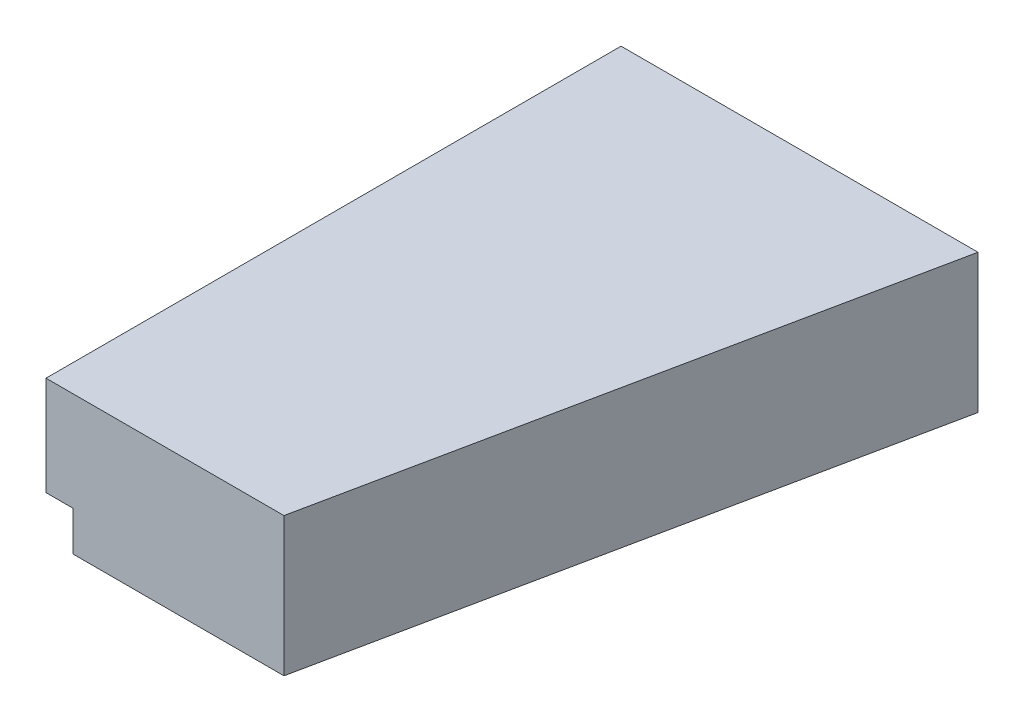
from build123d import *

# Parameters (mm, degrees)
BOSS_EXTRUDE1_DEPTH = 35
BOSS_EXTRUDE2_DEPTH = 10
SKETCH3_W           = 35.357177314
SKETCH3_H           = 3.5
CUT_EXTRUDE1_DEPTH  = 10
CUT_EXTRUDE2_DEPTH  = 0.625
CUT_EXTRUDE3_REACH  = 165.362
SKETCH5_R           = 1.9
SKETCH6_R           = 3.35
CUT_EXTRUDE4_DEPTH  = 2.5
LPATTERN1_COUNT     = 2
LPATTERN1_PITCH     = 52.5
SKETCH7_W           = 6.75
SKETCH7_H           = 145
CUT_EXTRUDE5_DEPTH  = 10


with BuildPart() as part:
    # Sketch1 → Boss-Extrude1 (new body)
    with BuildSketch(Plane(origin=(0, 0, 0), x_dir=(-1, 0, 0), z_dir=(0, 1, 0))):
        Polygon((16.563657866, 147.59508075), (-13.436342134, 2.59508075), (76.563657866, 2.59508075), (76.563657866, 147.59508075), align=None)
        Polygon((-2.190071172, 7.59508075), (24.706480552, 137.59508075), (66.563657866, 137.59508075), (66.563657866, 7.59508075), align=None, mode=Mode.SUBTRACT)
    extrude(amount=BOSS_EXTRUDE1_DEPTH)

    # Sketch2 → Boss-Extrude2 (add)
    with BuildSketch(Plane(origin=(0, 35, 0), x_dir=(-1, 0, 0), z_dir=(0, 1, 0))):
        Polygon((16.563657866, 147.59508075), (76.563657866, 147.59508075), (76.563657866, 2.59508075), (-13.436342134, 2.59508075), align=None)
    extrude(amount=-BOSS_EXTRUDE2_DEPTH)

    # Sketch3 → Cut-Extrude1 (cut)
    with BuildSketch(Plane.XZ):
        with Locations((-45.635069209, 142.59508075)):
            Rectangle(SKETCH3_W, SKETCH3_H)
        Polygon((-17.438004507, 135.780072214), (-20.865415976, 135.0709526), (4.714199322, 11.436145326), (8.141610791, 12.145264941), align=None)
    extrude(amount=-CUT_EXTRUDE1_DEPTH, mode=Mode.SUBTRACT)

    # Sketch4 → Cut-Extrude2 (cut)
    with BuildSketch(Plane(origin=(0, 0, 22.59508075), x_dir=(1, 0, 0), z_dir=(0, 1, 0))):
        Polygon((-66.563657866, 20), (-66.563657866, 15), (2.190071172, 15), (3.224553931, 20), align=None)
    extrude(amount=CUT_EXTRUDE2_DEPTH, mode=Mode.SUBTRACT)

    # Sketch5 → Cut-Extrude3 (cut, up to next)
    with BuildSketch(Plane.XY.offset(7.59508075), mode=Mode.PRIVATE) as cut_extrude3_sk1:
        with Locations((-59.313657866, 5.625)):
            Circle(SKETCH5_R)
    cut_extrude3_tool1 = extrude(cut_extrude3_sk1.sketch, amount=-CUT_EXTRUDE3_REACH, mode=Mode.PRIVATE) & part.part
    cut_extrude3 = cut_extrude3_tool1.solids().sort_by_distance((-59.313658, 5.625, 7.595081))[0]
    add(cut_extrude3, mode=Mode.SUBTRACT)

    # Sketch6 → Cut-Extrude4 (cut)
    with BuildSketch(Plane.XY.offset(7.59508075)):
        with Locations((-59.313657866, 5.625)):
            Circle(SKETCH6_R)
    cut_extrude4 = extrude(amount=-CUT_EXTRUDE4_DEPTH, mode=Mode.SUBTRACT)

    # LPattern1: Cut-Extrude3, Cut-Extrude4 ×2
    with Locations(*[(i * LPATTERN1_PITCH, 0, 0) for i in range(1, LPATTERN1_COUNT)]):
        add(cut_extrude3, mode=Mode.SUBTRACT)
        add(cut_extrude4, mode=Mode.SUBTRACT)

    # Sketch7 → Cut-Extrude5 (cut)
    with BuildSketch(Plane.XZ):
        with Locations((-73.188657866, 75.09508075)):
            Rectangle(SKETCH7_W, SKETCH7_H)
    extrude(amount=-CUT_EXTRUDE5_DEPTH, mode=Mode.SUBTRACT)


solid = part.part
